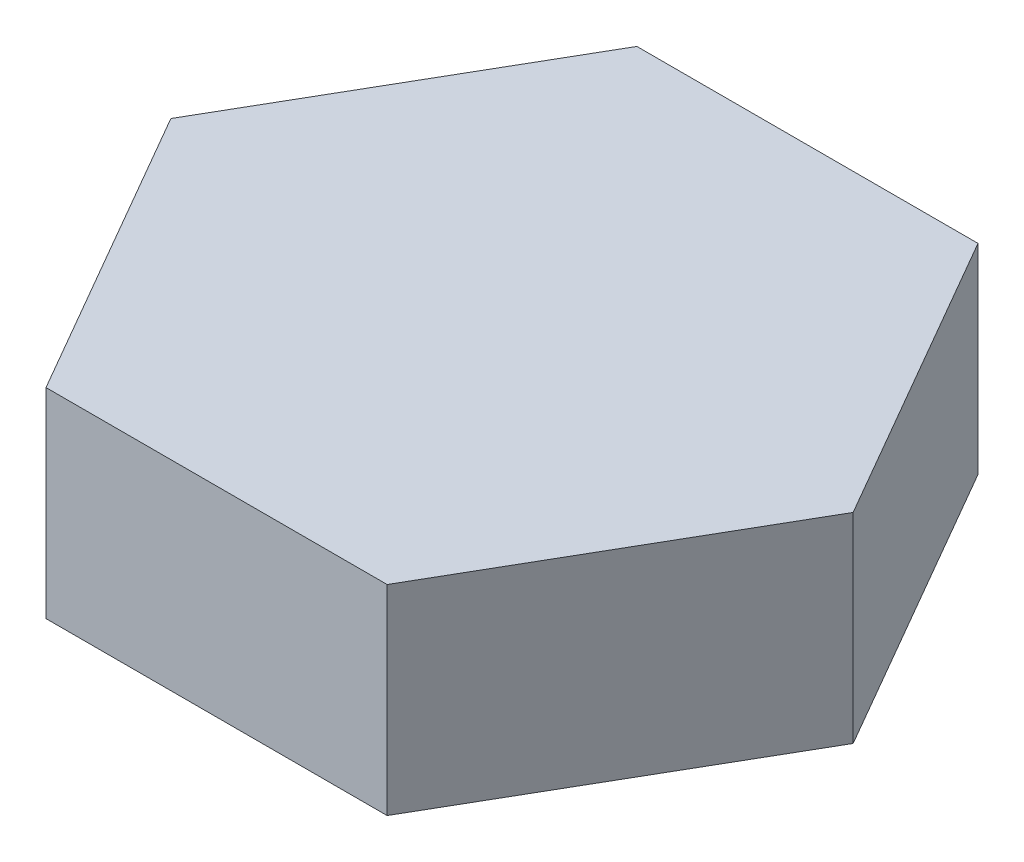
from build123d import *

# Parameters (mm, degrees)
BOSS_EXTRUDE1_DEPTH = 4.064


with BuildPart() as part:
    # Sketch1 → Boss-Extrude1 (new body)
    with BuildSketch(Plane(origin=(0, 0, 0), x_dir=(1, 0, 0), z_dir=(0, 1, 0))):
        Polygon((3.464101615, 6), (-3.464101615, 6), (-6.92820323, 0), (-3.464101615, -6), (3.464101615, -6), (6.92820323, 0), align=None)
    extrude(amount=BOSS_EXTRUDE1_DEPTH)


solid = part.part
